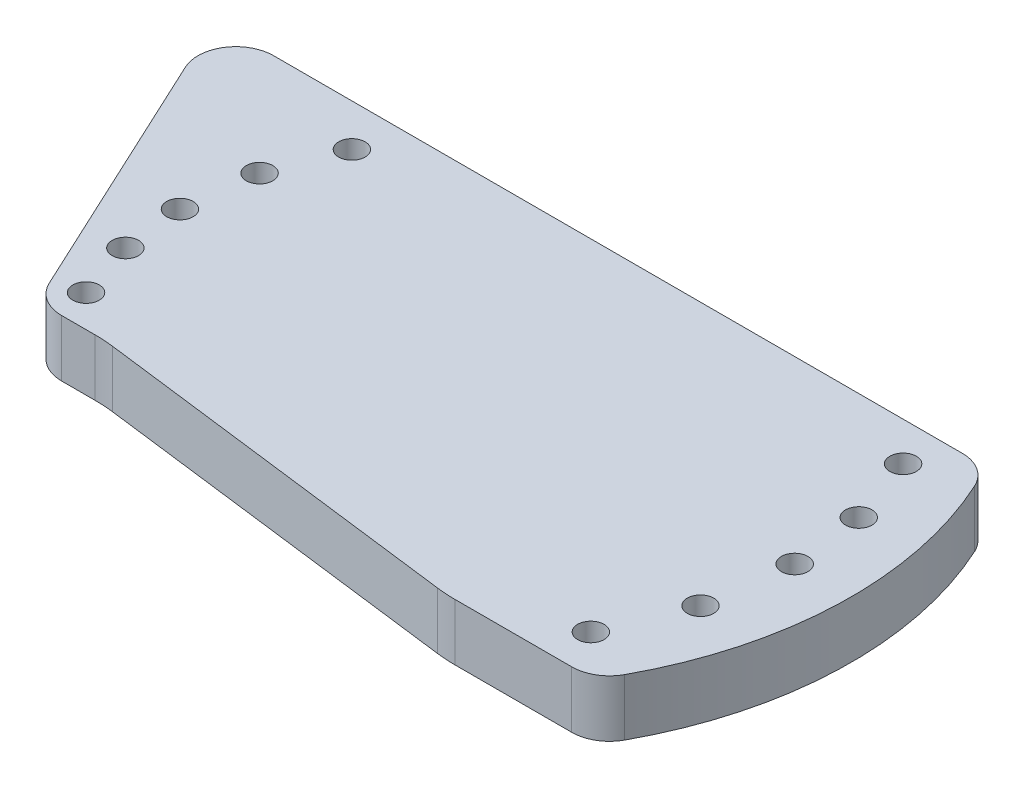
from build123d import *

# Parameters (mm, degrees)
BOSS_EXTRUDE1_DEPTH   = 4.7625
SKETCH2_R             = 2.2225
CUT_EXTRUDE1_DEPTH    = 73.495756083
SKETCH3_R             = 2.2225
CUT_EXTRUDE2_DEPTH    = 73.495756083
CIRPATTERN1_START     = -4.7625
CIRPATTERN1_OUTLINE_R = 2.2225
CIRPATTERN1_DEPTH     = 9.525
CIRPATTERN2_START     = -4.7625
CIRPATTERN2_OUTLINE_R = 2.2225
CIRPATTERN2_DEPTH     = 9.525
BOSS_EXTRUDE2_DEPTH   = 9.525
FILLET1_R             = 6.35
FILLET2_R             = 25.4


# Read off the part's stored shape, not the designer's step: CirPattern1, CirPattern2
with BuildPart() as part:
    # Sketch1 → Boss-Extrude1 (new, symmetric)
    with BuildSketch(Plane(origin=(0, 0, 0), x_dir=(1, 0, 0), z_dir=(0, 1, 0))):
        with BuildLine():
            Line((-44.760744171, 30.1625), (55.879098004, 30.1625))
            ThreePointArc((55.879098004, 30.1625), (63.467858945, -2.02011904), (53.847850236, -33.655))
            Line((53.847850236, -33.655), (29.036932948, -33.655))
            Line((29.036932948, -33.655), (-36.477972806, -25.4))
            Line((-36.477972806, -25.4), (-47.625, -25.4))
            ThreePointArc((-47.625, -25.4), (-53.903425523, 2.778730272), (-44.760744171, 30.1625))
        make_face()
    extrude(amount=BOSS_EXTRUDE1_DEPTH, both=True)

    # Sketch2 → Cut-Extrude1 (cut, through all)
    with BuildSketch(Plane(origin=(0, 4.7625, 0), x_dir=(1, 0, 0), z_dir=(0, 1, 0))):
        with Locations(Location((-49.2125, 0, 0), (0, 0, 270))):
            Circle(SKETCH2_R)
    extrude(amount=-CUT_EXTRUDE1_DEPTH, mode=Mode.SUBTRACT)

    # Sketch3 → Cut-Extrude2 (cut, through all)
    with BuildSketch(Plane(origin=(0, 4.7625, 0), x_dir=(1, 0, 0), z_dir=(0, 1, 0))):
        with Locations(Location((53.975, 0, 0), (0, 0, 270))):
            Circle(SKETCH3_R)
    extrude(amount=-CUT_EXTRUDE2_DEPTH, mode=Mode.SUBTRACT)

    # CirPattern1 outline → CirPattern1 (cut)
    with BuildSketch(Plane(origin=(0, 0, 0), x_dir=(1, 0, 0), z_dir=(0, 1, 0)).offset(CIRPATTERN1_START)):
        with Locations((-47.750678429, 11.905581287)):
            Circle(CIRPATTERN1_OUTLINE_R)
        with Locations((-43.452058414, 23.103869284)):
            Circle(CIRPATTERN1_OUTLINE_R)
        with Locations((-48.137088801, -10.231854084)):
            Circle(CIRPATTERN1_OUTLINE_R)
        with Locations((-44.957855834, -20.016527047)):
            Circle(CIRPATTERN1_OUTLINE_R)
    extrude(amount=CIRPATTERN1_DEPTH, mode=Mode.SUBTRACT)

    # CirPattern2 outline → CirPattern2 (cut)
    with BuildSketch(Plane(origin=(0, 0, 0), x_dir=(1, 0, 0), z_dir=(0, 1, 0)).offset(CIRPATTERN2_START)):
        with Locations((52.591624247, 12.141733158)):
            Circle(CIRPATTERN2_OUTLINE_R)
        with Locations((48.512408649, 23.661082648)):
            Circle(CIRPATTERN2_OUTLINE_R)
        with Locations((52.135846474, -13.969757959)):
            Circle(CIRPATTERN2_OUTLINE_R)
        with Locations((46.743721169, -26.9875)):
            Circle(CIRPATTERN2_OUTLINE_R)
    extrude(amount=CIRPATTERN2_DEPTH, mode=Mode.SUBTRACT)

    # Sketch4 → Boss-Extrude2 (add, through all)
    with BuildSketch(Plane(origin=(0, 4.7625, 0), x_dir=(1, 0, 0), z_dir=(0, 1, 0))):
        with BuildLine():
            Line((-48.917962805, -22.810820677), (-73.619827915, 30.1625))
            Line((-73.619827915, 30.1625), (-44.760744171, 30.1625))
            ThreePointArc((-44.760744171, 30.1625), (-53.809555017, 4.222844291), (-48.917962805, -22.810820677))
        make_face()
    extrude(amount=-BOSS_EXTRUDE2_DEPTH)

    # Fillet1
    fillet1_edges = [part.edges().sort_by_distance(p)[0] for p in [
        (55.879098004, 0, -30.1625),
        (53.847850236, 0, 33.655),
        (-47.625, 0, 25.4),
        (-73.619827915, 0, -30.1625),
    ]]
    fillet(fillet1_edges, radius=FILLET1_R)

    # Fillet2
    fillet2_edges = [part.edges().sort_by_distance(p)[0] for p in [
        (29.036932948, 0, 33.655),
        (-36.477972806, 0, 25.4),
    ]]
    fillet(fillet2_edges, radius=FILLET2_R)


solid = part.part
